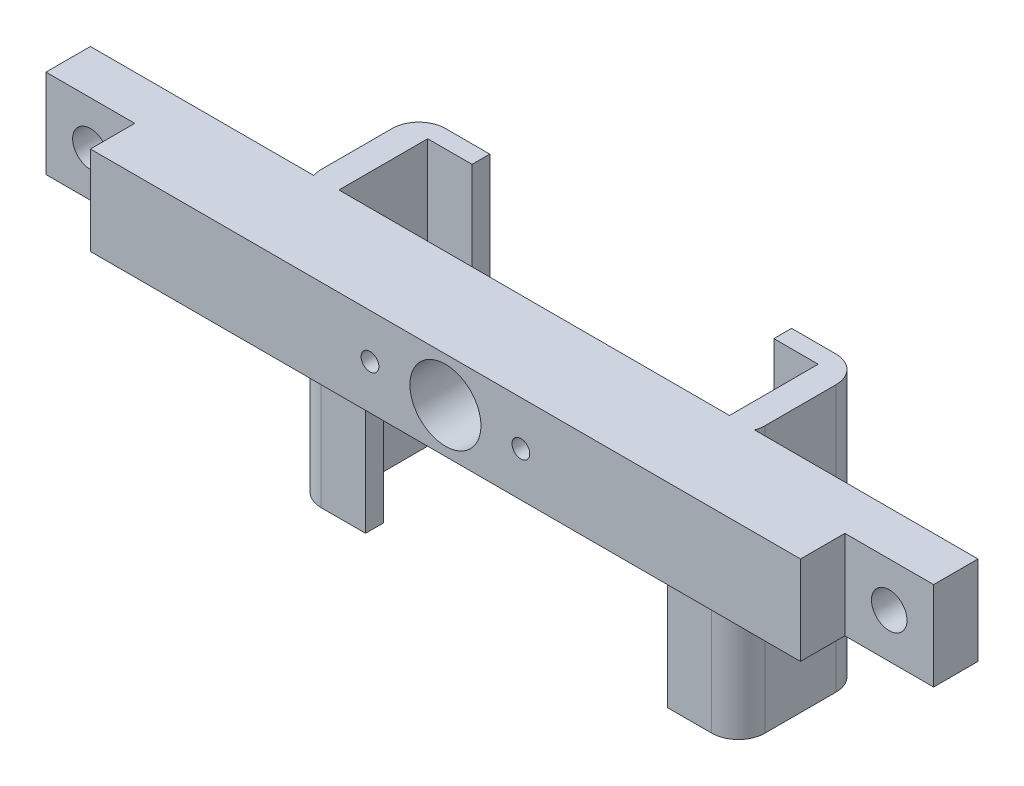
from build123d import *

# Parameters (mm, degrees)
SKETCH1_W           = 100
SKETCH1_H           = 10
BOSS_EXTRUDE1_DEPTH = 10
SKETCH6_W           = 3
SKETCH6_H           = 10
BOSS_EXTRUDE2_DEPTH = 12
SKETCH8_W           = 2
SKETCH8_H           = 10
BOSS_EXTRUDE3_DEPTH = 5
BOSS_EXTRUDE4_DEPTH = 20
SKETCH2_W           = 10
SKETCH2_H           = 5
CUT_EXTRUDE1_DEPTH  = 10
CUT_EXTRUDE2_REACH  = 60.429
SKETCH10_R          = 2
SKETCH13_R          = 4
SKETCH13_R_2        = 1
CUT_EXTRUDE3_DEPTH  = 58.175169436
FILLET1_R           = 3
FILLET2_R           = 3


with BuildPart() as part:
    # Sketch1 → Boss-Extrude1 (new body)
    with BuildSketch(Plane.XY):
        Rectangle(SKETCH1_W, SKETCH1_H)
    extrude(amount=BOSS_EXTRUDE1_DEPTH)

    # Sketch6 → Boss-Extrude2 (add)
    with BuildSketch(Plane(origin=(0, 0, 0), x_dir=(-1, 0, 0), z_dir=(0, 0, -1))):
        with Locations((-23.5, 0)):
            Rectangle(SKETCH6_W, SKETCH6_H)
    boss_extrude2 = extrude(amount=BOSS_EXTRUDE2_DEPTH)

    # Sketch8 → Boss-Extrude3 (add)
    with BuildSketch(Plane.ZY.offset(-22)):
        with Locations((-11, 0)):
            Rectangle(SKETCH8_W, SKETCH8_H)
    boss_extrude3 = extrude(amount=BOSS_EXTRUDE3_DEPTH)

    # Sketch9 → Boss-Extrude4 (add)
    with BuildSketch(Plane.XZ.offset(5)):
        Polygon((17, 2), (17, 0), (22, 0), (22, -10), (17, -10), (17, -12), (25, -12), (25, 0), (25, 2), align=None)
    boss_extrude4 = extrude(amount=BOSS_EXTRUDE4_DEPTH)

    # Mirror3: Boss-Extrude2, Boss-Extrude3, Boss-Extrude4 across plane
    add(boss_extrude2.mirror(Plane(origin=(0, 0, 0), x_dir=(0, 0, 1), z_dir=(1, 0, 0))))
    add(boss_extrude3.mirror(Plane(origin=(0, 0, 0), x_dir=(0, 0, 1), z_dir=(1, 0, 0))))
    add(boss_extrude4.mirror(Plane(origin=(0, 0, 0), x_dir=(0, 0, 1), z_dir=(1, 0, 0))))

    # Sketch2 → Cut-Extrude1 (cut)
    with BuildSketch(Plane(origin=(0, 5, 0), x_dir=(1, 0, 0), z_dir=(0, 1, 0))):
        with Locations((-45, -7.5)):
            Rectangle(SKETCH2_W, SKETCH2_H)
    cut_extrude1 = extrude(amount=-CUT_EXTRUDE1_DEPTH, mode=Mode.SUBTRACT)

    # Mirror4: Cut-Extrude1 across plane
    add(cut_extrude1.mirror(Plane(origin=(0, 0, 0), x_dir=(0, 0, 1), z_dir=(1, 0, 0))), mode=Mode.SUBTRACT)

    # Sketch10 → Cut-Extrude2 (cut, up to next)
    with BuildSketch(Plane.XY.offset(5), mode=Mode.PRIVATE) as cut_extrude2_sk1:
        with Locations((45, 0)):
            Circle(SKETCH10_R)
    cut_extrude2_tool1 = extrude(cut_extrude2_sk1.sketch, amount=-CUT_EXTRUDE2_REACH, mode=Mode.PRIVATE) & part.part
    cut_extrude2 = cut_extrude2_tool1.solids().sort_by_distance((45, 0, 5))[0]
    add(cut_extrude2, mode=Mode.SUBTRACT)

    # Mirror5: Cut-Extrude2 across plane
    add(cut_extrude2.mirror(Plane(origin=(0, 0, 0), x_dir=(0, 0, 1), z_dir=(1, 0, 0))), mode=Mode.SUBTRACT)

    # Sketch13 → Cut-Extrude3 (cut, through all)
    with BuildSketch(Plane(origin=(0, 0, 0), x_dir=(-1, 0, 0), z_dir=(0, 0, -1))):
        Circle(SKETCH13_R)
        with Locations((-8.5, 0)):
            Circle(SKETCH13_R_2)
        with Locations((8.5, 0)):
            Circle(SKETCH13_R_2)
    extrude(amount=-CUT_EXTRUDE3_DEPTH, mode=Mode.SUBTRACT)

    # Fillet1
    fillet1_edges = [part.edges().sort_by_distance(p)[0] for p in [
        (25, -10, -12),
        (-25, -10, -12),
    ]]
    fillet(fillet1_edges, radius=FILLET1_R)

    # Fillet2
    fillet2_edges = [part.edges().sort_by_distance(p)[0] for p in [
        (-25, -15, 2),
        (25, -15, 2),
    ]]
    fillet(fillet2_edges, radius=FILLET2_R)


solid = part.part
